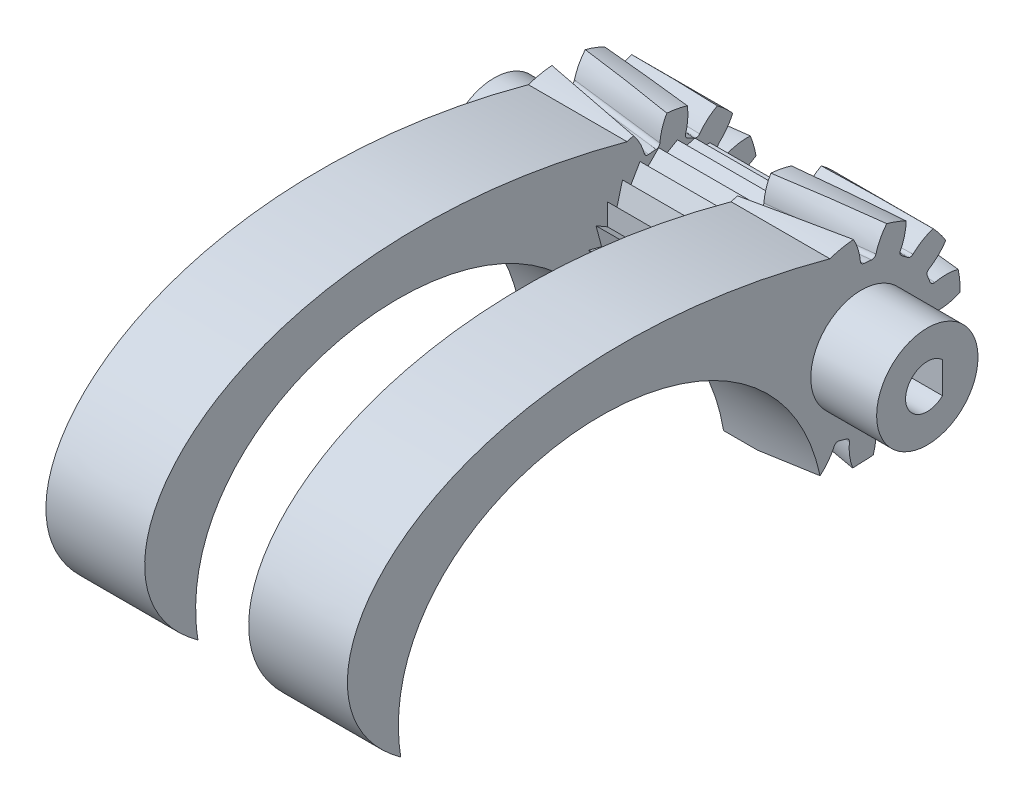
from build123d import *

# Parameters (mm, degrees)
CLAWSHAPE_DEPTH             = 3.75
GEARFILLET_R                = 0.3
GEARPATTERN_COUNT           = 7
GEARPATTERN_ANGLE           = 190
GEARFILLET_OF_GEARPATTERN_R = 0.3
SKETCH8_R                   = 3.85
BOSS_EXTRUDE1_DEPTH         = 5
BOSS_EXTRUDE2_DEPTH         = 3.95
CUT_EXTRUDE1_DEPTH          = 49.901847446
CUT_EXTRUDE1_DEPTH_BACK     = 49.901847446
CUT_EXTRUDE2_DEPTH          = 49.901847446


with BuildPart() as part:
    # Sketch1 → ClawShape (new, symmetric)
    with BuildSketch(Plane(origin=(0, 0, 0), x_dir=(0, 0, -1), z_dir=(1, 0, 0))):
        with BuildLine():
            add(Edge.make_bspline(
                [(-2.403846154, 7.104331332), (-33.284500973, 15.470565374), (-46.35649612, -1.133480969), (-35, -9.378221735)],
                knots=[0, 0, 0, 0, 1, 1, 1, 1], degree=3))
            Line((-35, -9.378221735), (0, -7.5))
            ThreePointArc((0, -7.5), (7.400421778, 1.218095853), (-2.403846154, 7.104331332))
        make_face()
    extrude(amount=CLAWSHAPE_DEPTH, both=True)

    # Sketch6 for GearCut → GearCut section 0
    with BuildSketch(Plane(origin=(-3.75, 0, 0), x_dir=(0, -0.08816349035423222, -0.9961060179361227), z_dir=(1, 0, 0))):
        with BuildLine():
            # circular arc as an exact rational Bezier (weights 1, cos(half-angle), 1)
            Bezier((-0.558541995, 5.471565666), (-0.732431488, 7.175014626), (-2.069978418, 8.244100275), weights=[1, 0.92207791, 1])
            Bezier((-2.069978418, 8.244100275), (0, 8.763842941), (2.069978418, 8.244100275), weights=[1, 0.96989415, 1])
            Bezier((2.069978418, 8.244100275), (0.732431488, 7.175014626), (0.558541995, 5.471565666), weights=[1, 0.92207791, 1])
            Bezier((0.558541995, 5.471565666), (0, 5.5285821), (-0.558541995, 5.471565666), weights=[1, 0.994830121, 1])
        make_face()
    # Sketch5 for GearCut → GearCut section 1
    with BuildSketch(Plane(origin=(3.75, 0, 0), x_dir=(0, 0.08816349035423282, -0.9961060179361226), z_dir=(1, 0, 0))):
        with BuildLine():
            Bezier((-0.558541995, 5.471565666), (-0.732431488, 7.175014626), (-2.069978418, 8.244100275), weights=[1, 0.92207791, 1])
            Bezier((-2.069978418, 8.244100275), (0, 8.763842941), (2.069978418, 8.244100275), weights=[1, 0.96989415, 1])
            Bezier((2.069978418, 8.244100275), (0.732431488, 7.175014626), (0.558541995, 5.471565666), weights=[1, 0.92207791, 1])
            Bezier((0.558541995, 5.471565666), (0, 5.5285821), (-0.558541995, 5.471565666), weights=[1, 0.994830121, 1])
        make_face()
    gearcut = loft(mode=Mode.SUBTRACT)

    # GearFillet
    gearfillet_edges = [part.edges().sort_by_distance(p)[0] for p in [
        (0, 5.450259488, 0.556367042),
        (0, 5.450259488, -0.556367042),
    ]]
    fillet(gearfillet_edges, radius=GEARFILLET_R)

    # GearPattern: GearCut ×7 about axis
    gearpattern_axis = Axis((3.75, 0, 0), (-1, 0, 0))
    for i in range(1, GEARPATTERN_COUNT):
        add(gearcut.rotate(gearpattern_axis, i * GEARPATTERN_ANGLE / (GEARPATTERN_COUNT - 1)), mode=Mode.SUBTRACT)

    # GearFillet of GearPattern
    gearfillet_of_gearpattern_edges = [part.edges().sort_by_distance(p)[0] for p in [
        (0, 4.930886386, -2.387725322),
        (0, 4.346727052, -3.334791853),
        (0, 2.943259739, -4.620832704),
        (0, 1.948884241, -5.120226849),
        (0, 0.079228484, -5.478010188),
        (0, -1.029271311, -5.381029022),
        (0, -2.808394372, -4.704018901),
        (0, -3.700944188, -4.039540182),
        (0, -4.859771029, -2.52932764),
        (0, -5.270599293, -1.495210974),
        (0, -5.464069922, 0.398513051),
        (0, -5.270845676, 1.494342204),
    ]]
    fillet(gearfillet_of_gearpattern_edges, radius=GEARFILLET_OF_GEARPATTERN_R)

    # Sketch8 → Boss-Extrude1 (add)
    with BuildSketch(Plane.ZY.offset(3.75)):
        Circle(SKETCH8_R)
    extrude(amount=BOSS_EXTRUDE1_DEPTH)

    # Sketch9 → Boss-Extrude2 (add)
    with BuildSketch(Plane(origin=(3.75, 0, 0), x_dir=(0, 0, -1), z_dir=(1, 0, 0))):
        Polygon((1.423504748, 5.312592045), (0, 4.490731195), (0, 5.5), (-1.16228676, 4.33771324), (-1.423504748, 5.312592045), (-2.245365598, 3.889087297), (-2.75, 4.763139721), (-3.175426481, 3.175426481), (-3.889087297, 3.889087297), (-3.889087297, 2.245365598), (-4.763139721, 2.75), (-4.33771324, 1.16228676), (-5.312592045, 1.423504748), (-4.490731195, 0), (-5.5, 0), (-4.33771324, -1.16228676), (-5.312592045, -1.423504748), (-3.889087297, -2.245365598), (-4.763139721, -2.75), (-3.175426481, -3.175426481), (-3.889087297, -3.889087297), (-2.245365598, -3.889087297), (-2.75, -4.763139721), (-1.16228676, -4.33771324), (-1.423504748, -5.312592045), (0, -4.490731195), (0, -5.5), (1.16228676, -4.33771324), (1.423504748, -5.312592045), (2.245365598, -3.889087297), (2.75, -4.763139721), (3.175426481, -3.175426481), (3.889087297, -3.889087297), (3.889087297, -2.245365598), (4.763139721, -2.75), (4.33771324, -1.16228676), (5.312592045, -1.423504748), (4.490731195, 0), (5.5, 0), (4.33771324, 1.16228676), (5.312592045, 1.423504748), (3.889087297, 2.245365598), (4.763139721, 2.75), (3.175426481, 3.175426481), (3.889087297, 3.889087297), (2.245365598, 3.889087297), (2.75, 4.763139721), (1.16228676, 4.33771324), align=None)
    extrude(amount=BOSS_EXTRUDE2_DEPTH)

    # Mirror1: part across plane


with BuildPart() as part_1:
    add(part.part)
    add(part.part.mirror(Plane(origin=(7.7, 0, 0), x_dir=(0, 0, 1), z_dir=(1, 0, 0))))

    # Sketch10 → Cut-Extrude1 (cut, two sides: drawn at the far end of the back side and taken through both)
    with BuildSketch(Plane(origin=(19.15, 0, 0), x_dir=(0, 0, -1), z_dir=(1, 0, 0)).offset(-CUT_EXTRUDE1_DEPTH_BACK)):
        with BuildLine():
            Line((1.15, -1.183215957), (1.15, 1.183215957))
            ThreePointArc((1.15, 1.183215957), (-1.65, 0), (1.15, -1.183215957))
        make_face()
    extrude(amount=CUT_EXTRUDE1_DEPTH + CUT_EXTRUDE1_DEPTH_BACK, mode=Mode.SUBTRACT)

    # Sketch11 → Cut-Extrude2 (cut, through all)
    with BuildSketch(Plane(origin=(19.15, 0, 0), x_dir=(0, 0, -1), z_dir=(1, 0, 0))):
        with BuildLine():
            Line((-35, -9.378221735), (-2.98021846, -7.659928907))
            add(Edge.make_bspline(
                [(-35, -9.378221735), (-36.618831189, 0.698729469), (-28.443251248, 9.923891354), (-5.731749008, 9.092863724), (-2.98021846, -7.659928907)],
                knots=[0, 0, 0, 0, 0, 1, 1, 1, 1, 1], degree=4))
        make_face()
    extrude(amount=-CUT_EXTRUDE2_DEPTH, mode=Mode.SUBTRACT)


solid = part_1.part
